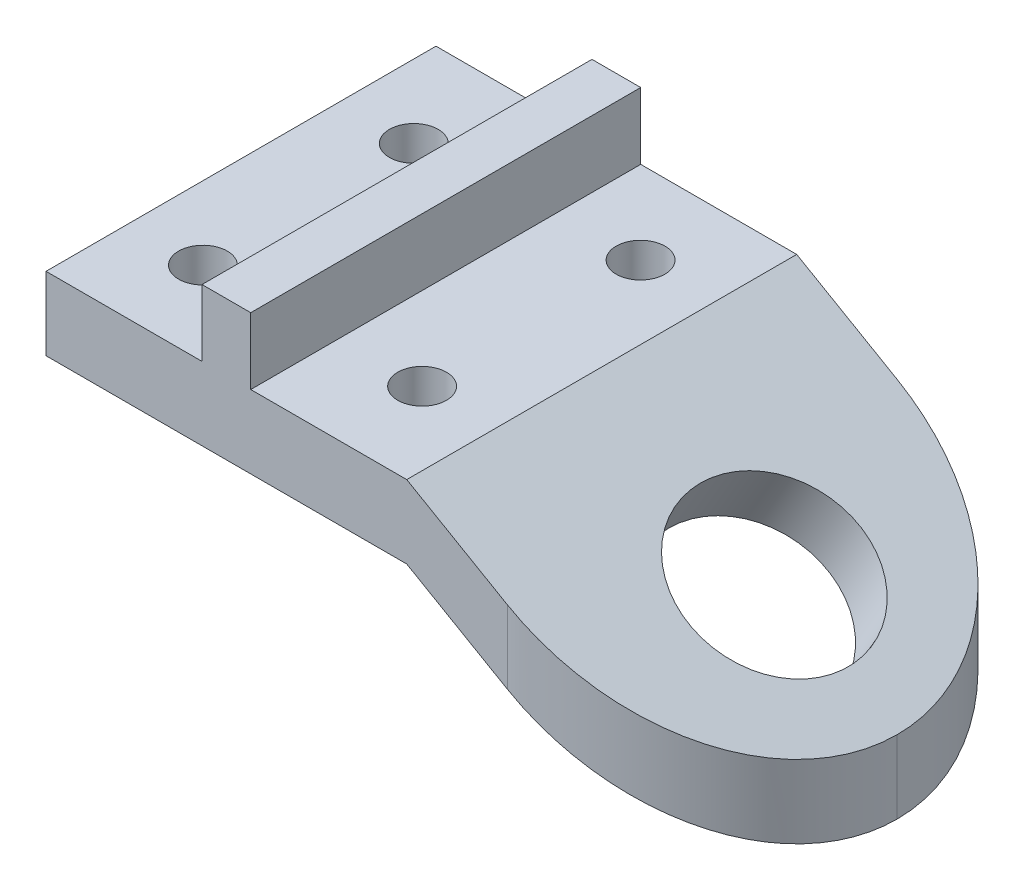
from build123d import *

# Parameters (mm, degrees)
BOSS_EXTRUDE1_DEPTH = 80
FILLET1_R           = 40
SKETCH3_R           = 5
CUT_EXTRUDE3_DEPTH  = 15
SKETCH4_R           = 5
CUT_EXTRUDE4_DEPTH  = 80
SKETCH5_R           = 17.5
CUT_EXTRUDE5_DEPTH  = 26


with BuildPart() as part:
    # Sketch2 → Boss-Extrude1 (new body)
    with BuildSketch(Plane.XY):
        Polygon((-28.453333333, 0), (45.546666667, 0), (106.168444932, -35), (106.168444932, -20), (45.546666667, 15), (13.546666667, 15), (13.546666667, 28.653333333), (3.546666667, 28.653333333), (3.546666667, 15), (-28.453333333, 15), align=None)
    extrude(amount=BOSS_EXTRUDE1_DEPTH)

    # Fillet1
    # the kernel refuses this fillet: 40 mm, written as the material it takes off along each edge
    with BuildSketch(Plane(origin=(106.168444932, -135, 0), x_dir=(0, 0, 1), z_dir=(0, 1, 0))) as fillet1_piece_1:
        with BuildLine():
            CenterArc((FILLET1_R, -FILLET1_R), FILLET1_R, 90, 90)
            Line((0, -FILLET1_R), (0, 0))
            Line((0, 0), (FILLET1_R, 0))
        make_face()
    extrude(amount=215, mode=Mode.SUBTRACT)
    with BuildSketch(Plane(origin=(106.168444932, -135, 80), x_dir=(0, 0, -1), z_dir=(0, 1, 0))) as fillet1_piece_2:
        with BuildLine():
            CenterArc((FILLET1_R, FILLET1_R), FILLET1_R, 180, 90)
            Line((0, FILLET1_R), (0, 0))
            Line((0, 0), (FILLET1_R, 0))
        make_face()
    extrude(amount=215, mode=Mode.SUBTRACT)

    # Sketch3 → Cut-Extrude3 (cut)
    with BuildSketch(Plane(origin=(0, 0, 0), x_dir=(1, 0, 0), z_dir=(0, 1, 0))):
        with Locations(Location((-13.453333333, -19.550801078, 0), (0, 0, 90))):
            Circle(SKETCH3_R)
        with Locations(Location((-13.453333333, -62.802123194, 0), (0, 0, 90))):
            Circle(SKETCH3_R)
    extrude(amount=CUT_EXTRUDE3_DEPTH, mode=Mode.SUBTRACT)

    # Sketch4 → Cut-Extrude4 (cut)
    with BuildSketch(Plane(origin=(0, 15, 0), x_dir=(1, 0, 0), z_dir=(0, 1, 0))):
        with Locations(Location((30.546666667, -17.032746755, 0), (0, 0, 270))):
            Circle(SKETCH4_R)
        with Locations(Location((30.546666667, -61.843602222, 0), (0, 0, 270))):
            Circle(SKETCH4_R)
    extrude(amount=-CUT_EXTRUDE4_DEPTH, mode=Mode.SUBTRACT)

    # Sketch5 → Cut-Extrude5 (cut)
    with BuildSketch(Plane(origin=(17.881857195, 30.972285196, 0), x_dir=(0.866025403784438, -0.5000000000000011, 0), z_dir=(0.5000000000000011, 0.8660254037844382, 0))):
        with Locations(Location((71.944570391, -39.229988433, 0), (0, 0, 180))):
            Circle(SKETCH5_R)
    extrude(amount=-CUT_EXTRUDE5_DEPTH, mode=Mode.SUBTRACT)


solid = part.part
